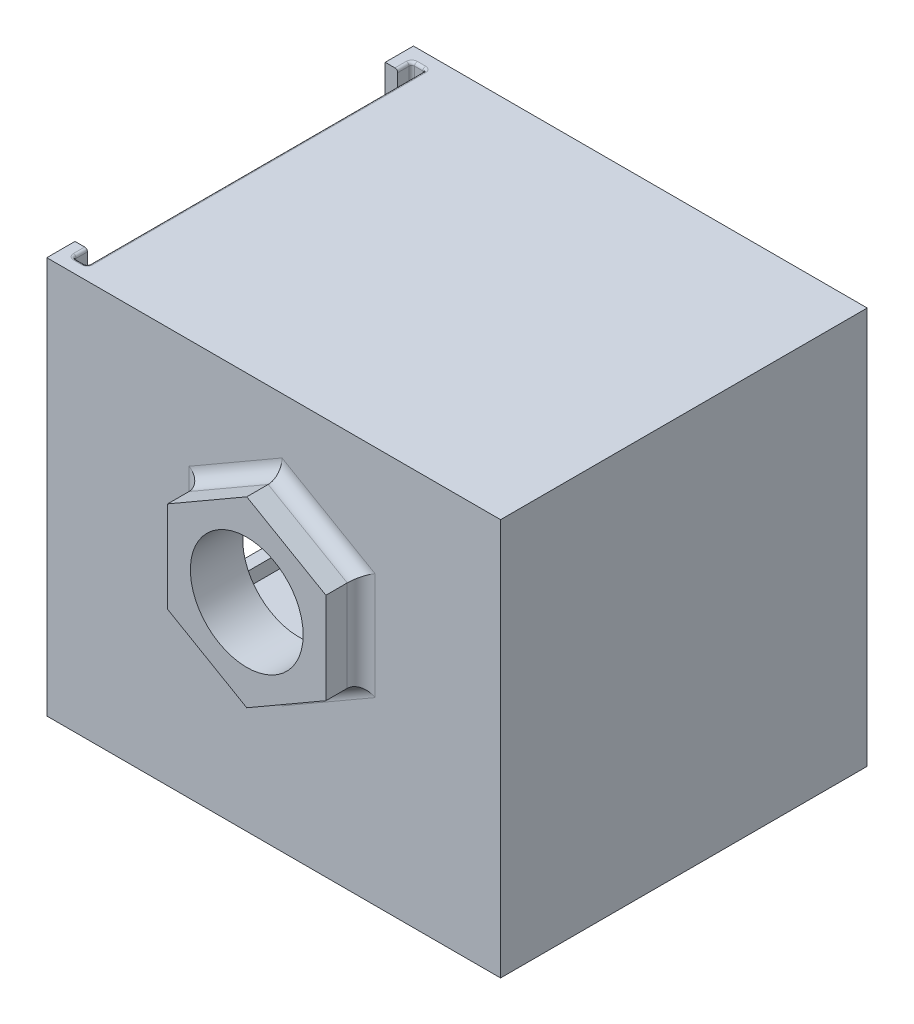
from build123d import *

# Parameters (mm, degrees)
SKETCH1_W            = 78.74
SKETCH1_H            = 66.04
SKETCH1_W_2          = 71.12
SKETCH1_H_2          = 55.88
BOSS_EXTRUDE1_DEPTH  = 63.5
SKETCH2_W            = 78.74
SKETCH2_H            = 66.04
BOSS_EXTRUDE2_DEPTH  = 4
CUT_EXTRUDE1_REACH   = 120.103
SKETCH3_W            = 13.462
SKETCH3_H            = 13.97
CUT_EXTRUDE2_REACH   = 120.103
SKETCH4_W            = 10.922
SKETCH4_H            = 13.97
SKETCH16_W           = 66.04
SKETCH16_H           = 67.5
SKETCH16_W_2         = 13.462
SKETCH16_H_2         = 13.97
SKETCH16_W_3         = 10.922
BOSS_EXTRUDE8_DEPTH  = 3
SKETCH17_W           = 81.74
SKETCH17_H           = 66.04
BOSS_EXTRUDE9_DEPTH  = 4
CUT_EXTRUDE10_DEPTH  = 64.77
SKETCH19_W           = 2.5
SKETCH19_H           = 60.96
CUT_EXTRUDE11_DEPTH  = 3
SKETCH20_W           = 55.88
SKETCH20_H           = 4
BOSS_EXTRUDE10_DEPTH = 2.25
SKETCH21_W           = 71.12
SKETCH21_H           = 55.88
BOSS_EXTRUDE11_DEPTH = 2.73
FILLET2_R            = 0.5
BOSS_EXTRUDE12_DEPTH = 6.35
SKETCH22_R           = 10.16
CUT_EXTRUDE12_DEPTH  = 11.35
CUT_EXTRUDE13_DEPTH  = 2
FILLET3_R            = 2.5


with BuildPart() as part:
    # Sketch1 → Boss-Extrude1 (new body)
    with BuildSketch(Plane(origin=(0, 0, 0), x_dir=(1, 0, 0), z_dir=(0, 1, 0))):
        with Locations((35.56, 27.94)):
            Rectangle(SKETCH1_W, SKETCH1_H)
        with Locations((35.56, 27.94)):
            Rectangle(SKETCH1_W_2, SKETCH1_H_2, mode=Mode.SUBTRACT)
    extrude(amount=BOSS_EXTRUDE1_DEPTH)

    # Sketch2 → Boss-Extrude2 (add)
    with BuildSketch(Plane(origin=(0, 0, 0), x_dir=(1, 0, 0), z_dir=(0, 1, 0))):
        with Locations((35.56, 27.94)):
            Rectangle(SKETCH2_W, SKETCH2_H)
    extrude(amount=-BOSS_EXTRUDE2_DEPTH)

    # Sketch3 → Cut-Extrude1 (cut, up to next)
    with BuildSketch(Plane.ZY.offset(3.81), mode=Mode.PRIVATE) as cut_extrude1_sk1:
        with Locations((-40.729, 11.875)):
            Rectangle(SKETCH3_W, SKETCH3_H)
    cut_extrude1_tool1 = extrude(cut_extrude1_sk1.sketch, amount=-CUT_EXTRUDE1_REACH, mode=Mode.PRIVATE) & part.part
    add(cut_extrude1_tool1.solids().sort_by_distance((-3.81, 11.875, -40.729))[0], mode=Mode.SUBTRACT)

    # Sketch4 → Cut-Extrude2 (cut, up to next)
    with BuildSketch(Plane.ZY.offset(3.81), mode=Mode.PRIVATE) as cut_extrude2_sk1:
        with Locations((-8.001, 11.875)):
            Rectangle(SKETCH4_W, SKETCH4_H)
    cut_extrude2_tool1 = extrude(cut_extrude2_sk1.sketch, amount=-CUT_EXTRUDE2_REACH, mode=Mode.PRIVATE) & part.part
    add(cut_extrude2_tool1.solids().sort_by_distance((-3.81, 11.875, -8.001))[0], mode=Mode.SUBTRACT)

    # Sketch16 → Boss-Extrude8 (add)
    with BuildSketch(Plane.ZY.offset(3.81)):
        with Locations((-27.94, 29.75)):
            Rectangle(SKETCH16_W, SKETCH16_H)
        with Locations((-40.729, 11.875)):
            Rectangle(SKETCH16_W_2, SKETCH16_H_2, mode=Mode.SUBTRACT)
        with Locations((-8.001, 11.875)):
            Rectangle(SKETCH16_W_3, SKETCH16_H_2, mode=Mode.SUBTRACT)
    extrude(amount=BOSS_EXTRUDE8_DEPTH)

    # Sketch17 → Boss-Extrude9 (add)
    with BuildSketch(Plane(origin=(0, 63.5, 0), x_dir=(1, 0, 0), z_dir=(0, 1, 0))):
        with Locations((34.06, 27.94)):
            Rectangle(SKETCH17_W, SKETCH17_H)
    extrude(amount=BOSS_EXTRUDE9_DEPTH)

    # Sketch18 → Cut-Extrude10 (cut)
    with BuildSketch(Plane(origin=(0, 67.5, 0), x_dir=(1, 0, 0), z_dir=(0, 1, 0))):
        Polygon((-4.560006, 58.42), (-2.060006, 58.42), (-2.060006, 55.88), (0.189988, 55.88), (0.189988, 0), (-2.060006, 0), (-2.060006, -2.54), (-4.560006, -2.54), (-4.560006, 0), (-6.81, 0), (-6.81, 55.88), (-4.560006, 55.88), align=None)
    extrude(amount=-CUT_EXTRUDE10_DEPTH, mode=Mode.SUBTRACT)

    # Sketch19 → Cut-Extrude11 (cut)
    with BuildSketch(Plane(origin=(0, 2.73, 0), x_dir=(1, 0, 0), z_dir=(0, 1, 0))):
        with Locations((-3.310006, 27.94)):
            Rectangle(SKETCH19_W, SKETCH19_H)
    extrude(amount=-CUT_EXTRUDE11_DEPTH, mode=Mode.SUBTRACT)

    # Sketch20 → Boss-Extrude10 (add)
    with BuildSketch(Plane.ZY.offset(-0.189988)):
        with Locations((-27.94, 65.5)):
            Rectangle(SKETCH20_W, SKETCH20_H)
    extrude(amount=BOSS_EXTRUDE10_DEPTH)

    # Sketch21 → Boss-Extrude11 (add)
    with BuildSketch(Plane(origin=(0, 0, 0), x_dir=(1, 0, 0), z_dir=(0, 1, 0))):
        with Locations((35.56, 27.94)):
            Rectangle(SKETCH21_W, SKETCH21_H)
    extrude(amount=BOSS_EXTRUDE11_DEPTH)

    # Fillet2
    fillet2_edges = [part.edges().sort_by_distance(p)[0] for p in [
        (-2.060006, 33.615, -58.42),
    ]]
    fillet(fillet2_edges, radius=FILLET2_R)
    fillet2_2_edges = [part.edges().sort_by_distance(p)[0] for p in [
        (-2.060006, -0.27, -27.69),
    ]]
    fillet(fillet2_2_edges, radius=FILLET2_R)
    fillet2_3_edges = [part.edges().sort_by_distance(p)[0] for p in [
        (-2.060006, 33.865, 2.54),
    ]]
    fillet(fillet2_3_edges, radius=FILLET2_R)
    fillet2_4_edges = [part.edges().sort_by_distance(p)[0] for p in [
        (-4.560006, 33.865, 2.54),
    ]]
    fillet(fillet2_4_edges, radius=FILLET2_R)
    fillet2_5_edges = [part.edges().sort_by_distance(p)[0] for p in [
        (-3.310006, 67.5, 2.54),
    ]]
    fillet(fillet2_5_edges, radius=FILLET2_R)
    fillet2_6_edges = [part.edges().sort_by_distance(p)[0] for p in [
        (-4.560006, 67.5, -56.9),
    ]]
    fillet(fillet2_6_edges, radius=FILLET2_R)
    fillet2_7_edges = [part.edges().sort_by_distance(p)[0] for p in [
        (-2.060012, 67.5, -27.94),
    ]]
    fillet(fillet2_7_edges, radius=FILLET2_R - 0.0001)  # a hair under: the kernel refuses the full size

    # Sketch11 → Boss-Extrude12 (add)
    with BuildSketch(Plane.XY.offset(5.08)):
        Polygon((49.81, 46.327241336), (49.81, 29.872758664), (35.56, 21.645517328), (21.31, 29.872758664), (21.31, 46.327241336), (35.56, 54.554482672), align=None)
    extrude(amount=BOSS_EXTRUDE12_DEPTH)

    # Sketch22 → Cut-Extrude12 (cut)
    with BuildSketch(Plane.XY.offset(11.43)):
        with Locations((35.56, 38.1)):
            Circle(SKETCH22_R)
    extrude(amount=-CUT_EXTRUDE12_DEPTH, mode=Mode.SUBTRACT)

    # Sketch23 → Cut-Extrude13 (cut)
    with BuildSketch(Plane(origin=(0, 0, 0), x_dir=(-1, 0, 0), z_dir=(0, 0, -1))):
        Polygon((-21.31, 46.327241336), (-21.31, 29.872758664), (-35.56, 21.645517328), (-49.81, 29.872758664), (-49.81, 46.327241336), (-35.56, 54.554482672), align=None)
    extrude(amount=-CUT_EXTRUDE13_DEPTH, mode=Mode.SUBTRACT)

    # Fillet3
    fillet3_edges = [part.edges().sort_by_distance(p)[0] for p in [
        (42.685, 50.440862004, 5.08),
        (28.435, 50.440862004, 5.08),
        (21.31, 38.1, 5.08),
        (28.435, 25.759137996, 5.08),
        (42.685, 25.759137996, 5.08),
        (49.81, 38.1, 5.08),
    ]]
    fillet(fillet3_edges, radius=FILLET3_R)


solid = part.part
